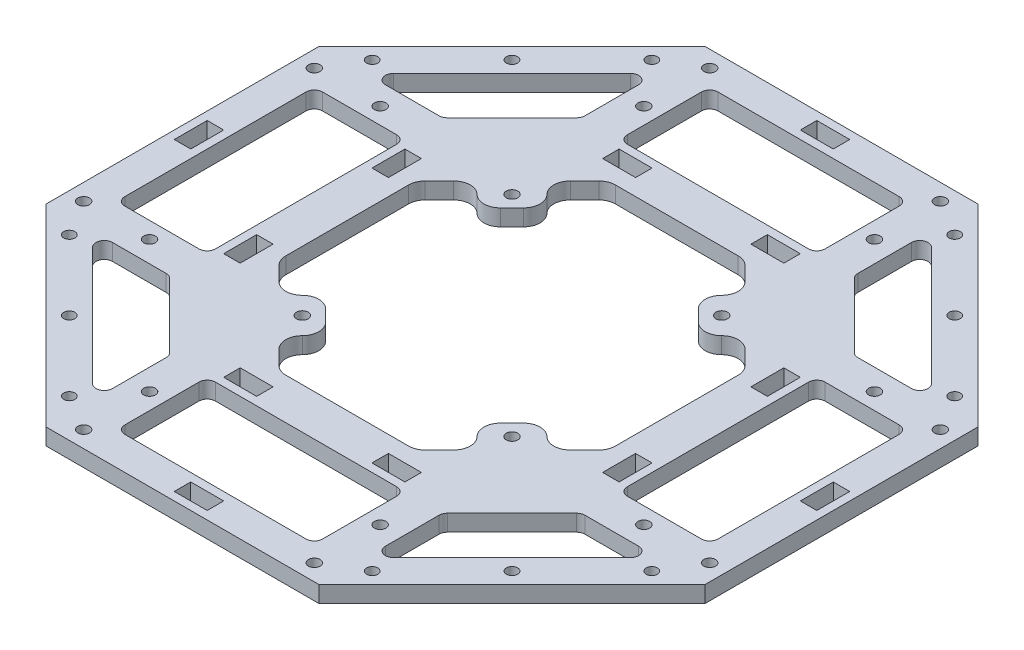
from build123d import *

# Parameters (mm, degrees)
BASE_DEPTH                                 = 6.35
WHEEL_CUTOUT_REACH                         = 181.717
SKETCH3_W                                  = 76.2
SKETCH3_H                                  = 34.925
WHEEL_CUTOUT_FILLETS_R                     = 3.175
WHEEL_CUTOUT_PATTERN_COUNT                 = 4
WHEEL_CUTOUT_FILLETS_OF_WHEEL_CUTOUT_PAT_R = 3.175
SUPPORT_CUTOUTS_REACH                      = 181.717
SKETCH4_W                                  = 12.7
SKETCH4_H                                  = 6.35
SUPPORT_CUTOUT_PATTERN_COUNT               = 4
LIGHTENING_HOLE_DEPTH                      = 180.717340566
FILLET2_R                                  = 3.175
LIGHTENING_HOLE_PATTERN_COUNT              = 4
FILLET2_OF_LIGHTENING_HOLE_PATTERN_R       = 3.175
CUT_EXTRUDE1_REACH                         = 181.717
LIGHT_SENSOR_MOUNT_DEPTH                   = 6.35
CIRPATTERN1_COUNT                          = 4
LINE_TRACKER_MOUNTING_HOLES_D              = 4.4958
CIRPATTERN2_COUNT                          = 4
FILLET3_R                                  = 6.35
ALIGNER_MOUNTING_HOLES_D                   = 4.4958
CIRPATTERN3_COUNT                          = 4
F_8_CLEARANCE_HOLE2_D                      = 4.3053
CIRPATTERN4_COUNT                          = 4


with BuildPart() as part:
    # Base sketch → Base (new body)
    with BuildSketch(Plane(origin=(0, 0, 0), x_dir=(1, 0, 0), z_dir=(0, 1, 0))):
        Polygon((-127, 52.605122421), (-127, -52.605122421), (-52.605122421, -127), (52.605122421, -127), (127, -52.605122421), (127, 52.605122421), (52.605122421, 127), (-52.605122421, 127), align=None)
    extrude(amount=BASE_DEPTH)

    # Sketch3 → Wheel cutout (cut, up to next)
    with BuildSketch(Plane(origin=(0, 6.35, 0), x_dir=(1, 0, 0), z_dir=(0, 1, 0)), mode=Mode.PRIVATE) as wheel_cutout_sk1:
        with Locations((0, 96.8375)):
            Rectangle(SKETCH3_W, SKETCH3_H)
    wheel_cutout_tool1 = extrude(wheel_cutout_sk1.sketch, amount=-WHEEL_CUTOUT_REACH, mode=Mode.PRIVATE) & part.part
    wheel_cutout = wheel_cutout_tool1.solids().sort_by_distance((0, 6.35, -96.8375))[0]
    add(wheel_cutout, mode=Mode.SUBTRACT)

    # Wheel cutout fillets
    wheel_cutout_fillets_edges = [part.edges().sort_by_distance(p)[0] for p in [
        (-38.1, 3.175, -79.375),
        (-38.1, 3.175, -114.3),
        (38.1, 3.175, -114.3),
        (38.1, 3.175, -79.375),
    ]]
    fillet(wheel_cutout_fillets_edges, radius=WHEEL_CUTOUT_FILLETS_R)

    # Wheel cutout pattern: Wheel cutout ×4 about axis
    wheel_cutout_pattern_axis = Axis((0, 0, 0), (0, 1, 0))
    for i in range(1, WHEEL_CUTOUT_PATTERN_COUNT):
        add(wheel_cutout.rotate(wheel_cutout_pattern_axis, i * 360 / WHEEL_CUTOUT_PATTERN_COUNT), mode=Mode.SUBTRACT)

    # Wheel cutout fillets of Wheel cutout pat
    wheel_cutout_fillets_of_wheel_cutout_pat_edges = [part.edges().sort_by_distance(p)[0] for p in [
        (-79.375, 3.175, 38.1),
        (-114.3, 3.175, 38.1),
        (-114.3, 3.175, -38.1),
        (-79.375, 3.175, -38.1),
        (38.1, 3.175, 79.375),
        (38.1, 3.175, 114.3),
        (-38.1, 3.175, 114.3),
        (-38.1, 3.175, 79.375),
        (79.375, 3.175, -38.1),
        (114.3, 3.175, -38.1),
        (114.3, 3.175, 38.1),
        (79.375, 3.175, 38.1),
    ]]
    fillet(wheel_cutout_fillets_of_wheel_cutout_pat_edges, radius=WHEEL_CUTOUT_FILLETS_OF_WHEEL_CUTOUT_PAT_R)

    # Sketch4 → Support cutouts (cut, up to next)
    with BuildSketch(Plane(origin=(0, 6.35, 0), x_dir=(1, 0, 0), z_dir=(0, 1, 0)), mode=Mode.PRIVATE) as support_cutouts_sk1:
        with Locations((28.575, 73.025)):
            Rectangle(SKETCH4_W, SKETCH4_H)
    support_cutouts_tool1 = extrude(support_cutouts_sk1.sketch, amount=-SUPPORT_CUTOUTS_REACH, mode=Mode.PRIVATE) & part.part
    # Sketch4 → Support cutouts (cut, up to next)
    with BuildSketch(Plane(origin=(0, 6.35, 0), x_dir=(1, 0, 0), z_dir=(0, 1, 0)), mode=Mode.PRIVATE) as support_cutouts_sk2:
        with Locations((-28.575, 73.025)):
            Rectangle(SKETCH4_W, SKETCH4_H)
    support_cutouts_tool2 = extrude(support_cutouts_sk2.sketch, amount=-SUPPORT_CUTOUTS_REACH, mode=Mode.PRIVATE) & part.part
    # Sketch4 → Support cutouts (cut, up to next)
    with BuildSketch(Plane(origin=(0, 6.35, 0), x_dir=(1, 0, 0), z_dir=(0, 1, 0)), mode=Mode.PRIVATE) as support_cutouts_sk3:
        with Locations((0, 120.65)):
            Rectangle(SKETCH4_W, SKETCH4_H)
    support_cutouts_tool3 = extrude(support_cutouts_sk3.sketch, amount=-SUPPORT_CUTOUTS_REACH, mode=Mode.PRIVATE) & part.part
    support_cutouts_1 = support_cutouts_tool1.solids().sort_by_distance((28.575, 6.35, -73.025))[0]
    add(support_cutouts_1, mode=Mode.SUBTRACT)
    support_cutouts_2 = support_cutouts_tool2.solids().sort_by_distance((-28.575, 6.35, -73.025))[0]
    add(support_cutouts_2, mode=Mode.SUBTRACT)
    support_cutouts_3 = support_cutouts_tool3.solids().sort_by_distance((0, 6.35, -120.65))[0]
    add(support_cutouts_3, mode=Mode.SUBTRACT)
    support_cutouts = support_cutouts_1 + support_cutouts_2 + support_cutouts_3  # Support cutouts as one shape, for the pattern or mirror that repeats it

    # Support cutout pattern: Support cutouts ×4 about axis
    support_cutout_pattern_axis = Axis((0, 0, 0), (0, 1, 0))
    for i in range(1, SUPPORT_CUTOUT_PATTERN_COUNT):
        add(support_cutouts.rotate(support_cutout_pattern_axis, i * 360 / SUPPORT_CUTOUT_PATTERN_COUNT), mode=Mode.SUBTRACT)

    # Sketch9 → Lightening hole (cut, through all)
    with BuildSketch(Plane(origin=(0, 6.35, 0), x_dir=(1, 0, 0), z_dir=(0, 1, 0))):
        Polygon((-109.039487758, 52.605122421), (-52.605122421, 109.039487758), (-52.605122421, 79.375), (-79.375, 52.605122421), align=None)
    lightening_hole = extrude(amount=-LIGHTENING_HOLE_DEPTH, mode=Mode.SUBTRACT)

    # Fillet2
    fillet2_edges = [part.edges().sort_by_distance(p)[0] for p in [
        (-79.375, 3.175, -52.605122421),
        (-109.039487758, 3.175, -52.605122421),
        (-52.605122421, 3.175, -109.039487758),
        (-52.605122421, 3.175, -79.375),
    ]]
    fillet(fillet2_edges, radius=FILLET2_R)

    # Lightening hole pattern: Lightening hole ×4 about axis
    lightening_hole_pattern_axis = Axis((0, 0, 0), (0, 1, 0))
    for i in range(1, LIGHTENING_HOLE_PATTERN_COUNT):
        add(lightening_hole.rotate(lightening_hole_pattern_axis, i * 360 / LIGHTENING_HOLE_PATTERN_COUNT), mode=Mode.SUBTRACT)

    # Fillet2 of Lightening hole pattern
    fillet2_of_lightening_hole_pattern_edges = [part.edges().sort_by_distance(p)[0] for p in [
        (-52.605122421, 3.175, 79.375),
        (-52.605122421, 3.175, 109.039487758),
        (-109.039487758, 3.175, 52.605122421),
        (-79.375, 3.175, 52.605122421),
        (79.375, 3.175, 52.605122421),
        (109.039487758, 3.175, 52.605122421),
        (52.605122421, 3.175, 109.039487758),
        (52.605122421, 3.175, 79.375),
        (52.605122421, 3.175, -79.375),
        (52.605122421, 3.175, -109.039487758),
        (109.039487758, 3.175, -52.605122421),
        (79.375, 3.175, -52.605122421),
    ]]
    fillet(fillet2_of_lightening_hole_pattern_edges, radius=FILLET2_OF_LIGHTENING_HOLE_PATTERN_R)

    # Sketch17 → Cut-Extrude1 (cut, up to next)
    with BuildSketch(Plane(origin=(0, 6.35, 0), x_dir=(1, 0, 0), z_dir=(0, 1, 0)), mode=Mode.PRIVATE) as cut_extrude1_sk1:
        Polygon((-63.5, 26.302561211), (-63.5, -26.302561211), (-26.302561211, -63.5), (26.302561211, -63.5), (63.5, -26.302561211), (63.5, 26.302561211), (26.302561211, 63.5), (-26.302561211, 63.5), align=None)
    cut_extrude1_tool1 = extrude(cut_extrude1_sk1.sketch, amount=-CUT_EXTRUDE1_REACH, mode=Mode.PRIVATE) & part.part
    add(cut_extrude1_tool1.solids().sort_by_distance((0, 6.35, 0))[0], mode=Mode.SUBTRACT)

    # Sketch18 → Light sensor mount (add, through all)
    with BuildSketch(Plane(origin=(0, 6.35, 0), x_dir=(1, 0, 0), z_dir=(0, 1, 0))):
        Polygon((-38.166088515, 51.636472696), (-29.185832393, 42.656216575), (-42.656216575, 29.185832393), (-51.636472696, 38.166088515), align=None)
    light_sensor_mount = extrude(amount=-LIGHT_SENSOR_MOUNT_DEPTH)

    # CirPattern1: Light sensor mount ×4 about axis
    cirpattern1_axis = Axis((0, 0, 0), (0, 1, 0))
    for i in range(1, CIRPATTERN1_COUNT):
        add(light_sensor_mount.rotate(cirpattern1_axis, i * 360 / CIRPATTERN1_COUNT))

    # Line tracker mounting holes (through all)
    with Locations(Plane(origin=(0, 6.35, 0), x_dir=(1, 0, 0), z_dir=(0, 1, 0))):
        with Locations((-40.411152545, 40.411152545)):
            line_tracker_mounting_holes = Hole(LINE_TRACKER_MOUNTING_HOLES_D / 2)

    # CirPattern2: Line tracker mounting holes ×4 about axis
    cirpattern2_axis = Axis((0, 0, 0), (0, 1, 0))
    for i in range(1, CIRPATTERN2_COUNT):
        add(line_tracker_mounting_holes.rotate(cirpattern2_axis, i * 360 / CIRPATTERN2_COUNT), mode=Mode.SUBTRACT)

    # Fillet3
    fillet3_edges = [part.edges().sort_by_distance(p)[0] for p in [
        (26.302561211, 3.175, -63.5),
        (38.166088515, 3.175, -51.636472696),
        (29.185832393, 3.175, -42.656216575),
        (42.656216575, 3.175, -29.185832393),
        (51.636472696, 3.175, -38.166088515),
        (63.5, 3.175, -26.302561211),
        (63.5, 3.175, 26.302561211),
        (51.636472696, 3.175, 38.166088515),
        (42.656216575, 3.175, 29.185832393),
        (29.185832393, 3.175, 42.656216575),
        (38.166088515, 3.175, 51.636472696),
        (26.302561211, 3.175, 63.5),
        (-26.302561211, 3.175, 63.5),
        (-38.166088515, 3.175, 51.636472696),
        (-29.185832393, 3.175, 42.656216575),
        (-42.656216575, 3.175, 29.185832393),
        (-51.636472696, 3.175, 38.166088515),
        (-63.5, 3.175, 26.302561211),
        (-63.5, 3.175, -26.302561211),
        (-51.636472696, 3.175, -38.166088515),
        (-29.185832393, 3.175, -42.656216575),
        (-38.166088515, 3.175, -51.636472696),
        (-26.302561211, 3.175, -63.5),
        (-42.656216575, 3.175, -29.185832393),
    ]]
    fillet(fillet3_edges, radius=FILLET3_R - 0.0001)  # a hair under: the kernel refuses the full size

    # Aligner mounting holes (through all)
    with Locations(Plane(origin=(0, 6.35, 0), x_dir=(1, 0, 0), z_dir=(0, 1, 0))):
        with Locations((-44.45, -95.25), (-44.45, -120.65), (44.45, -120.65), (44.45, -95.25)):
            aligner_mounting_holes = Hole(ALIGNER_MOUNTING_HOLES_D / 2)

    # CirPattern3: Aligner mounting holes ×4 about axis
    cirpattern3_axis = Axis((0, 0, 0), (0, 1, 0))
    for i in range(1, CIRPATTERN3_COUNT):
        add(aligner_mounting_holes.rotate(cirpattern3_axis, i * 360 / CIRPATTERN3_COUNT), mode=Mode.SUBTRACT)

    # #8 Clearance Hole2 (through all)
    with Locations(Plane(origin=(0, 6.35, 0), x_dir=(1, 0, 0), z_dir=(0, 1, 0))):
        with Locations((-58.371664787, 112.253201513), (-85.31243315, 85.31243315), (-112.253201513, 58.371664787)):
            f_8_clearance_hole2 = Hole(F_8_CLEARANCE_HOLE2_D / 2)

    # CirPattern4: #8 Clearance Hole2 ×4 about axis
    cirpattern4_axis = Axis((0, 0, 0), (0, 1, 0))
    for i in range(1, CIRPATTERN4_COUNT):
        add(f_8_clearance_hole2.rotate(cirpattern4_axis, i * 360 / CIRPATTERN4_COUNT), mode=Mode.SUBTRACT)


solid = part.part
